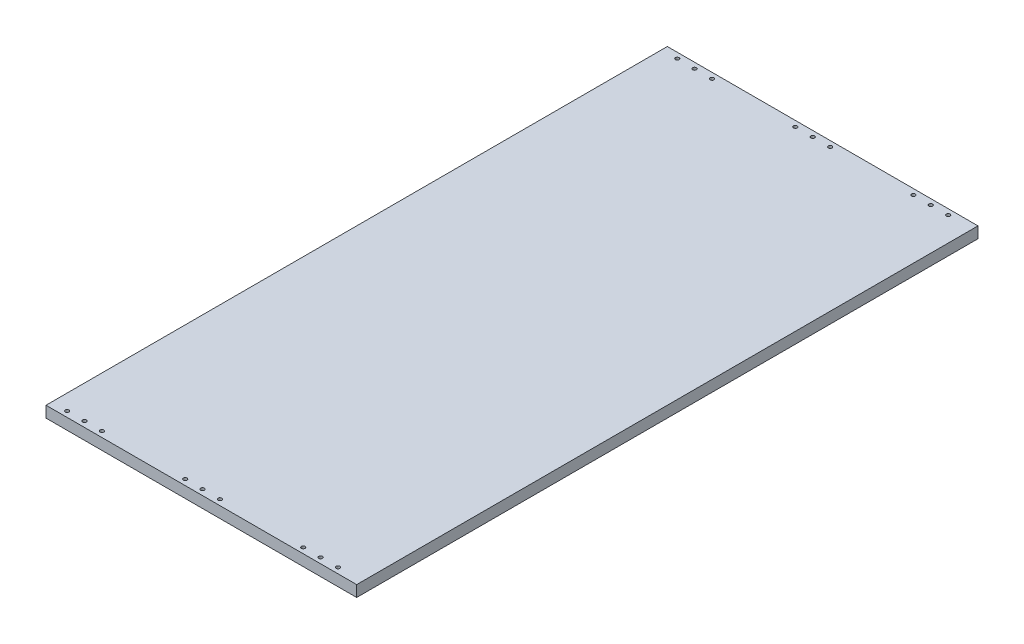
from build123d import *

# Parameters (mm, degrees)
SKETCH_2_W          = 500
SKETCH_2_H          = 1000
EXTRUDE_1_DEPTH     = 18
SKETCH_3_R          = 3
CUT_EXTRUDE_1_DEPTH = 9


with BuildPart() as part:
    # Эскиз2 → Бобышка-Вытянуть1 (new body)
    with BuildSketch(Plane(origin=(0, 0, 0), x_dir=(1, 0, 0), z_dir=(0, 1, 0))):
        with Locations((250, 500)):
            Rectangle(SKETCH_2_W, SKETCH_2_H)
    extrude(amount=EXTRUDE_1_DEPTH)

    # Эскиз3 → Вырез-Вытянуть1 (cut)
    with BuildSketch(Plane(origin=(0, 18, 0), x_dir=(1, 0, 0), z_dir=(0, 1, 0))):
        with Locations((25, 9)):
            Circle(SKETCH_3_R)
        with Locations((53, 9)):
            Circle(SKETCH_3_R)
        with Locations((81, 9)):
            Circle(SKETCH_3_R)
        with Locations((215, 9)):
            Circle(SKETCH_3_R)
        with Locations((243, 9)):
            Circle(SKETCH_3_R)
        with Locations((271, 9)):
            Circle(SKETCH_3_R)
        with Locations((405, 9)):
            Circle(SKETCH_3_R)
        with Locations((433, 9)):
            Circle(SKETCH_3_R)
        with Locations((461, 9)):
            Circle(SKETCH_3_R)
        with Locations((461, 991)):
            Circle(SKETCH_3_R)
        with Locations((433, 991)):
            Circle(SKETCH_3_R)
        with Locations((405, 991)):
            Circle(SKETCH_3_R)
        with Locations((271, 991)):
            Circle(SKETCH_3_R)
        with Locations((243, 991)):
            Circle(SKETCH_3_R)
        with Locations((215, 991)):
            Circle(SKETCH_3_R)
        with Locations((81, 991)):
            Circle(SKETCH_3_R)
        with Locations((53, 991)):
            Circle(SKETCH_3_R)
        with Locations((25, 991)):
            Circle(SKETCH_3_R)
    extrude(amount=-CUT_EXTRUDE_1_DEPTH, mode=Mode.SUBTRACT)


solid = part.part
